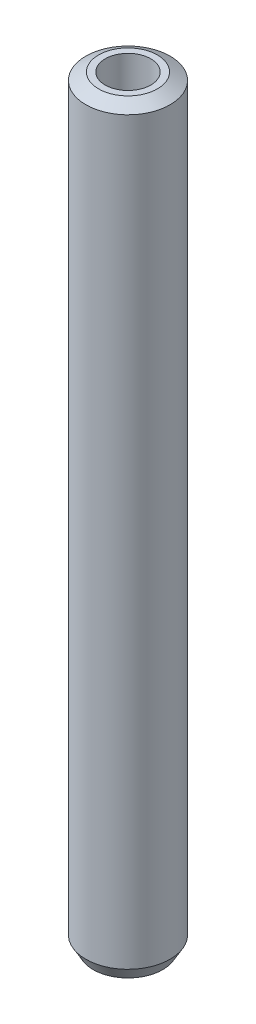
from build123d import *
from OCP.BRepFilletAPI import BRepFilletAPI_MakeChamfer

# Parameters (mm, degrees)
SKETCH1_R           = 32.5
BOSS_EXTRUDE1_DEPTH = 586.143162076
SKETCH2_R           = 17.574388502
CUT_EXTRUDE1_DEPTH  = 588.942434639
CHAMFER1_SIZE       = 5.670776507
CHAMFER1_SIZE2      = 9.822073029


with BuildPart() as part:
    # Sketch1 → Boss-Extrude1 (new body)
    with BuildSketch(Plane(origin=(0, 0, 0), x_dir=(1, 0, 0), z_dir=(0, 1, 0))):
        Circle(SKETCH1_R)
    extrude(amount=BOSS_EXTRUDE1_DEPTH)

    # Sketch2 → Cut-Extrude1 (cut, through all)
    with BuildSketch(Plane(origin=(0, 0, 0), x_dir=(1, 0, 0), z_dir=(0, 1, 0))):
        Circle(SKETCH2_R)
    extrude(amount=CUT_EXTRUDE1_DEPTH, mode=Mode.SUBTRACT)

    # Chamfer1: one chamfer whose edges measure the first distance from different faces: ONE call of the kernel's chamfer builder (chamfer() names one face for all edges)
    chamfer1_edges_1 = [part.edges().sort_by_distance(p)[0] for p in [
        (-32.5, 586.143162076, 0),
    ]]
    chamfer1_side_1 = [part.faces().sort_by_distance(p)[0] for p in [
        (-32.5, 293.071581038, 0),
    ]]
    chamfer1_edges_2 = [part.edges().sort_by_distance(p)[0] for p in [
        (-32.5, 0, 0),
    ]]
    chamfer1_side_2 = [part.faces().sort_by_distance(p)[0] for p in [
        (-31.580761184, 0, 0),
    ]]
    chamfer1 = BRepFilletAPI_MakeChamfer(part.part.solid().wrapped)
    for e in chamfer1_edges_1:
        chamfer1.Add(CHAMFER1_SIZE, CHAMFER1_SIZE2, e.wrapped, chamfer1_side_1[0].wrapped)  # the first distance lies on this face
    for e in chamfer1_edges_2:
        chamfer1.Add(CHAMFER1_SIZE, CHAMFER1_SIZE2, e.wrapped, chamfer1_side_2[0].wrapped)  # the first distance lies on this face
    add(Compound.cast(chamfer1.Shape()), mode=Mode.REPLACE)


solid = part.part
